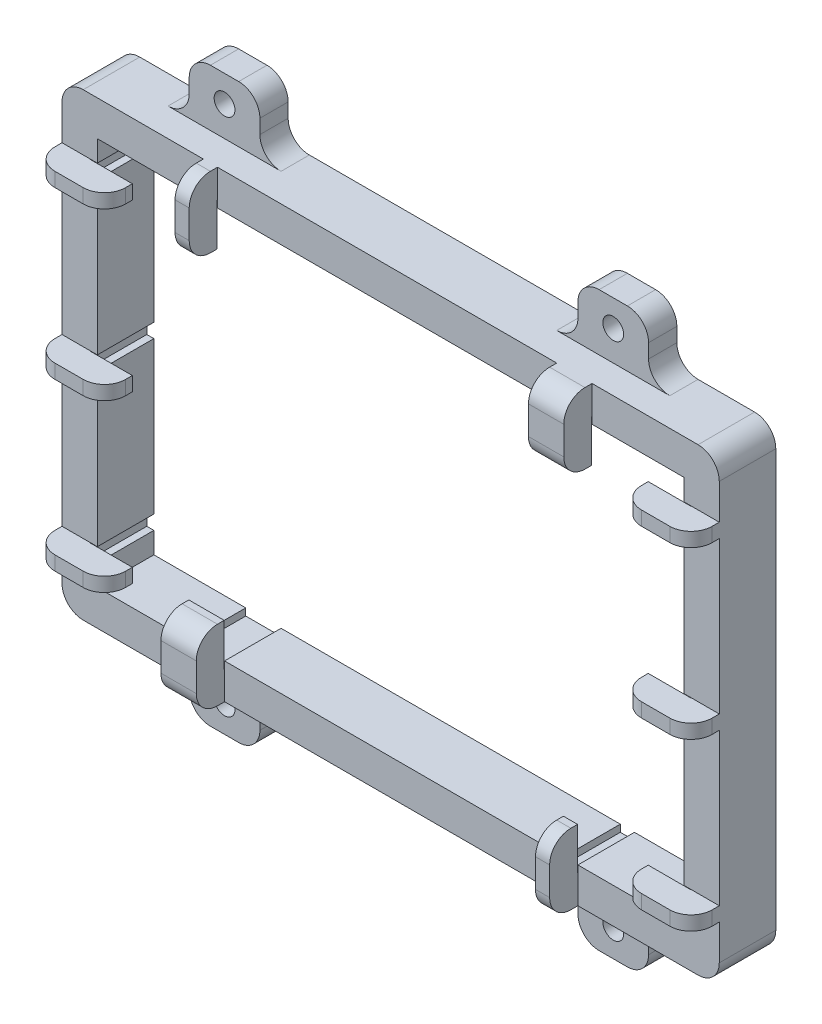
from build123d import *

# Parameters (mm, degrees)
SKETCH1_W               = 93
SKETCH1_H               = 65
SKETCH1_W_2             = 83
SKETCH1_H_2             = 55
BOSS_EXTRUDE1_DEPTH     = 8
FILLET1_R               = 3
SKETCH2_W               = 10
SKETCH2_H               = 4
BOSS_EXTRUDE6_DEPTH     = 8
FILLET3_R               = 3
SKETCH9_R               = 1.47
CUT_EXTRUDE1_DEPTH      = 62.794012655
MIRROR4_COPY_1_SKETCH_R = 1.47
MIRROR4_COPY_1_DEPTH    = 62.794012655
MIRROR4_COPY_2_SKETCH_R = 1.47
MIRROR4_COPY_2_DEPTH    = 62.794012655
FILLET4_R               = 3
SKETCH10_W              = 2
SKETCH10_H              = 1
SKETCH10_W_2            = 5
CUT_EXTRUDE2_DEPTH      = 63.181186865
SKETCH11_W              = 2
SKETCH11_H              = 1
SKETCH11_W_2            = 5
CUT_EXTRUDE3_DEPTH      = 63.181186865
SKETCH12_W              = 1
SKETCH12_H              = 2
CUT_EXTRUDE4_DEPTH      = 63.181186865
SKETCH14_W              = 4
SKETCH14_H              = 2
BOSS_EXTRUDE14_DEPTH    = 4
SKETCH15_W              = 3.95
SKETCH15_H              = 2
BOSS_EXTRUDE18_DEPTH    = 6
SKETCH16_W              = 2
SKETCH16_H              = 4
SKETCH16_W_2            = 5
BOSS_EXTRUDE19_DEPTH    = 4
SKETCH17_W              = 2
SKETCH17_H              = 3.95
SKETCH17_W_2            = 5
BOSS_EXTRUDE20_DEPTH    = 6
SKETCH18_W              = 5
SKETCH18_H              = 3.95
SKETCH18_W_2            = 2
BOSS_EXTRUDE21_DEPTH    = 6
FILLET6_R               = 3


with BuildPart() as part:
    # Sketch1 → Boss-Extrude1 (new body)
    with BuildSketch(Plane.XY):
        Rectangle(SKETCH1_W, SKETCH1_H)
        Rectangle(SKETCH1_W_2, SKETCH1_H_2, mode=Mode.SUBTRACT)
    extrude(amount=BOSS_EXTRUDE1_DEPTH)

    # Fillet1
    fillet1_edges = [part.edges().sort_by_distance(p)[0] for p in [
        (-46.5, -32.5, 4),
        (-46.5, 32.5, 4),
        (46.5, -32.5, 4),
        (46.5, 32.5, 4),
    ]]
    fillet(fillet1_edges, radius=FILLET1_R)

    # Sketch2 → Boss-Extrude6 (add)
    with BuildSketch(Plane(origin=(0, 32.5, 0), x_dir=(1, 0, 0), z_dir=(0, 1, 0))):
        with Locations((-27.5, -2)):
            Rectangle(SKETCH2_W, SKETCH2_H)
        with Locations((27.5, -2)):
            Rectangle(SKETCH2_W, SKETCH2_H)
    boss_extrude6 = extrude(amount=BOSS_EXTRUDE6_DEPTH)

    # Mirror2: Boss-Extrude6 across plane
    add(boss_extrude6.mirror(Plane.ZX))

    # Fillet3
    fillet3_edges = [part.edges().sort_by_distance(p)[0] for p in [
        (32.5, -32.5, 2),
        (22.5, -32.5, 2),
        (-22.5, -32.5, 2),
        (-32.5, -32.5, 2),
        (-32.5, 32.5, 2),
        (-22.5, 32.5, 2),
        (22.5, 32.5, 2),
        (32.5, 32.5, 2),
    ]]
    fillet(fillet3_edges, radius=FILLET3_R)

    # Sketch9 → Cut-Extrude1 (cut, through all)
    with BuildSketch(Plane.XY.offset(4)):
        with Locations((27.5, -36.742693553)):
            Circle(SKETCH9_R)
    cut_extrude1 = extrude(amount=-CUT_EXTRUDE1_DEPTH, mode=Mode.SUBTRACT)

    # Mirror3: Cut-Extrude1 across plane
    add(cut_extrude1.mirror(Plane(origin=(0, 0, 0), x_dir=(0, 0, 1), z_dir=(1, 0, 0))), mode=Mode.SUBTRACT)

    # Mirror4 copy 1 sketch → Mirror4 copy 1 (cut, through all)
    with BuildSketch(Plane(origin=(0, 0, 4), x_dir=(-1, 0, 0), z_dir=(0, 0, 1))):
        with Locations((27.5, -36.742693553)):
            Circle(MIRROR4_COPY_1_SKETCH_R)
    extrude(amount=-MIRROR4_COPY_1_DEPTH, mode=Mode.SUBTRACT)

    # Mirror4 copy 2 sketch → Mirror4 copy 2 (cut, through all)
    with BuildSketch(Plane.XY.offset(4)):
        with Locations((27.5, 36.742693553)):
            Circle(MIRROR4_COPY_2_SKETCH_R)
    extrude(amount=-MIRROR4_COPY_2_DEPTH, mode=Mode.SUBTRACT)

    # Fillet4
    fillet4_edges = [part.edges().sort_by_distance(p)[0] for p in [
        (-22.5, 40.5, 2),
        (-32.5, 40.5, 2),
        (22.5, 40.5, 2),
        (32.5, 40.5, 2),
        (32.5, -40.5, 2),
        (22.5, -40.5, 2),
        (-22.5, -40.5, 2),
        (-32.5, -40.5, 2),
    ]]
    fillet(fillet4_edges, radius=FILLET4_R)

    # Sketch10 → Cut-Extrude2 (cut, through all)
    with BuildSketch(Plane(origin=(0, 0, 0), x_dir=(-1, 0, 0), z_dir=(0, 0, -1))):
        with Locations((-25.5, -28)):
            Rectangle(SKETCH10_W, SKETCH10_H)
        with Locations((26, -28)):
            Rectangle(SKETCH10_W_2, SKETCH10_H)
    extrude(amount=-CUT_EXTRUDE2_DEPTH, mode=Mode.SUBTRACT)

    # Sketch11 → Cut-Extrude3 (cut, through all)
    with BuildSketch(Plane(origin=(0, 0, 0), x_dir=(-1, 0, 0), z_dir=(0, 0, -1))):
        with Locations((25.5, 28)):
            Rectangle(SKETCH11_W, SKETCH11_H)
        with Locations((-26, 28)):
            Rectangle(SKETCH11_W_2, SKETCH11_H)
    extrude(amount=-CUT_EXTRUDE3_DEPTH, mode=Mode.SUBTRACT)

    # Sketch12 → Cut-Extrude4 (cut, through all)
    with BuildSketch(Plane(origin=(0, 0, 0), x_dir=(-1, 0, 0), z_dir=(0, 0, -1))):
        with Locations((-42, 0)):
            Rectangle(SKETCH12_W, SKETCH12_H)
        with Locations((-42, -23.5)):
            Rectangle(SKETCH12_W, SKETCH12_H)
        with Locations((-42, 23.5)):
            Rectangle(SKETCH12_W, SKETCH12_H)
    cut_extrude4 = extrude(amount=-CUT_EXTRUDE4_DEPTH, mode=Mode.SUBTRACT)

    # Mirror5: Cut-Extrude4 across plane
    add(cut_extrude4.mirror(Plane(origin=(0, 0, 0), x_dir=(0, 0, 1), z_dir=(1, 0, 0))), mode=Mode.SUBTRACT)

    # Sketch14 → Boss-Extrude14 (add)
    with BuildSketch(Plane.XY.offset(8)):
        with Locations((44.5, 23.5)):
            Rectangle(SKETCH14_W, SKETCH14_H)
        with Locations((44.5, 0)):
            Rectangle(SKETCH14_W, SKETCH14_H)
        with Locations((44.5, -23.5)):
            Rectangle(SKETCH14_W, SKETCH14_H)
    boss_extrude14 = extrude(amount=BOSS_EXTRUDE14_DEPTH)

    # Mirror6: Boss-Extrude14 across plane
    add(boss_extrude14.mirror(Plane(origin=(0, 0, 0), x_dir=(0, 0, 1), z_dir=(1, 0, 0))))

    # Sketch15 → Boss-Extrude18 (add)
    with BuildSketch(Plane.ZY.offset(-42.5)):
        with Locations((10.025, 23.5)):
            Rectangle(SKETCH15_W, SKETCH15_H)
        with Locations((10.025, 0)):
            Rectangle(SKETCH15_W, SKETCH15_H)
        with Locations((10.025, -23.5)):
            Rectangle(SKETCH15_W, SKETCH15_H)
    boss_extrude18 = extrude(amount=BOSS_EXTRUDE18_DEPTH)

    # Mirror7: Boss-Extrude18 across plane
    add(boss_extrude18.mirror(Plane(origin=(0, 0, 0), x_dir=(0, 0, 1), z_dir=(1, 0, 0))))

    # Sketch16 → Boss-Extrude19 (add)
    with BuildSketch(Plane.XY.offset(8)):
        with Locations((-25.5, 30.5)):
            Rectangle(SKETCH16_W, SKETCH16_H)
        with Locations((26, 30.5)):
            Rectangle(SKETCH16_W_2, SKETCH16_H)
        with Locations((25.5, -30.5)):
            Rectangle(SKETCH16_W, SKETCH16_H)
        with Locations((-26, -30.5)):
            Rectangle(SKETCH16_W_2, SKETCH16_H)
    extrude(amount=BOSS_EXTRUDE19_DEPTH)

    # Sketch17 → Boss-Extrude20 (add)
    with BuildSketch(Plane.XZ.offset(-28.5)):
        with Locations((-25.5, 10.025)):
            Rectangle(SKETCH17_W, SKETCH17_H)
        with Locations((26, 10.025)):
            Rectangle(SKETCH17_W_2, SKETCH17_H)
    extrude(amount=BOSS_EXTRUDE20_DEPTH)

    # Sketch18 → Boss-Extrude21 (add)
    with BuildSketch(Plane(origin=(0, -28.5, 0), x_dir=(1, 0, 0), z_dir=(0, 1, 0))):
        with Locations((-26, -10.025)):
            Rectangle(SKETCH18_W, SKETCH18_H)
        with Locations((25.5, -10.025)):
            Rectangle(SKETCH18_W_2, SKETCH18_H)
    extrude(amount=BOSS_EXTRUDE21_DEPTH)

    # Fillet6
    fillet6_edges = [part.edges().sort_by_distance(p)[0] for p in [
        (-25.5, 32.5, 12),
        (-25.5, 22.5, 12),
        (-46.5, 23.5, 12),
        (-36.5, 23.5, 12),
        (-46.5, 0, 12),
        (-36.5, 0, 12),
        (-46.5, -23.5, 12),
        (-36.5, -23.5, 12),
        (-26, -32.5, 12),
        (-26, -22.5, 12),
        (25.5, -32.5, 12),
        (25.5, -22.5, 12),
        (36.5, -23.5, 12),
        (46.5, -23.5, 12),
        (46.5, 0, 12),
        (36.5, 0, 12),
        (36.5, 23.5, 12),
        (26, 22.5, 12),
        (26, 32.5, 12),
        (46.5, 23.5, 12),
    ]]
    fillet(fillet6_edges, radius=FILLET6_R)


solid = part.part
